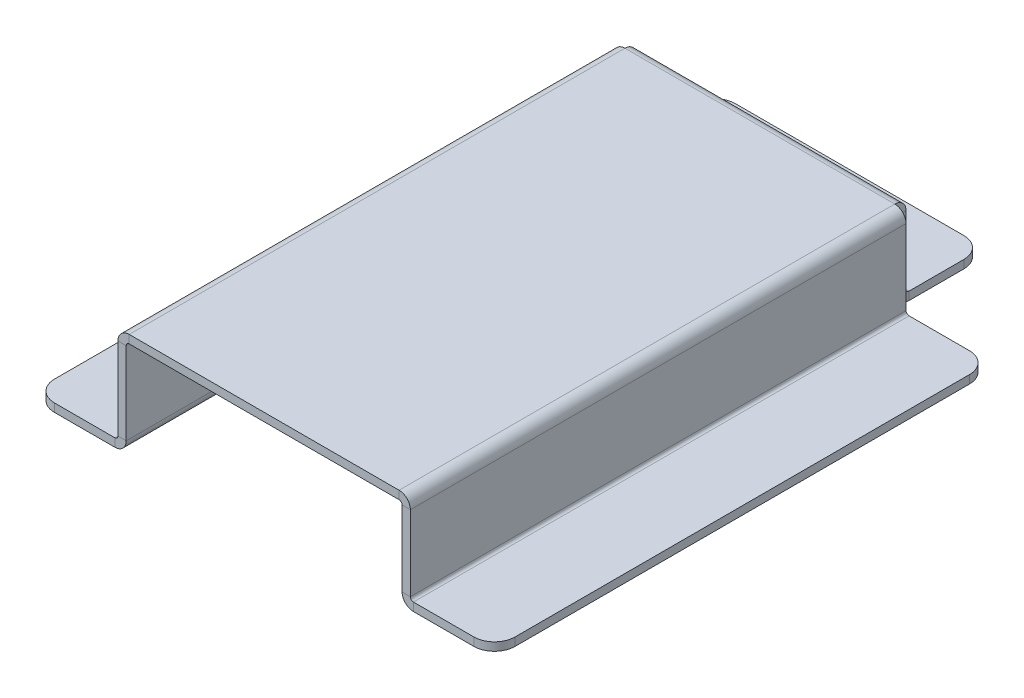
from build123d import *

# Parameters (mm, degrees)
SKETCH3_W                    = 66.802
SKETCH3_H                    = 120
BASE_FLANGE1_DEPTH           = 1.99
EDGE_FLANGE1_STRIP_W         = 9.4332
EDGE_FLANGE1_STRIP_H         = 1.99
EDGE_FLANGE1_STRIP_CUT_DEPTH = 120
EDGE_FLANGE1_DEPTH           = 120
EDGE_FLANGE2_STRIP_W         = 9.4332
EDGE_FLANGE2_STRIP_H         = 1.99
EDGE_FLANGE2_STRIP_CUT_DEPTH = 120
EDGE_FLANGE2_DEPTH           = 120
EDGE_FLANGE3_STRIP_W         = 9.4332
EDGE_FLANGE3_STRIP_H         = 1.99
EDGE_FLANGE3_STRIP_CUT_DEPTH = 120
EDGE_FLANGE3_DEPTH           = 120
EDGE_FLANGE4_STRIP_W         = 9.4332
EDGE_FLANGE4_STRIP_H         = 1.99
EDGE_FLANGE4_STRIP_CUT_DEPTH = 120
EDGE_FLANGE4_DEPTH           = 120
EDGE_FLANGE6_DEPTH           = 65.3288
EDGE_FLANGE7_STRIP_W         = 9.4332
EDGE_FLANGE7_STRIP_H         = 1.99
EDGE_FLANGE7_STRIP_CUT_DEPTH = 65.3288
EDGE_FLANGE7_DEPTH           = 65.3288
FILLET1_R                    = 5


# Sheet-metal steps are written as plain solids
with BuildPart() as part:
    # Sketch3 → Base-Flange1 (new body)
    with BuildSketch(Plane(origin=(0, 0, 0), x_dir=(1, 0, 0), z_dir=(0, 1, 0))):
        Rectangle(SKETCH3_W, SKETCH3_H)
    extrude(amount=-BASE_FLANGE1_DEPTH)

    # Edge-Flange1 strip (across the edge) → Edge-Flange1 strip cut (cut)
    with BuildSketch(Plane(origin=(33.401, -1.99, -60), x_dir=(-1, 0, 0), z_dir=(0, 0, 1))):
        with Locations((-3.98, -0.995)):
            Rectangle(EDGE_FLANGE1_STRIP_W, EDGE_FLANGE1_STRIP_H)
    extrude(amount=EDGE_FLANGE1_STRIP_CUT_DEPTH, mode=Mode.SUBTRACT)

    # Edge-Flange1 section (across the edge) → Edge-Flange1 (add)
    with BuildSketch(Plane(origin=(33.401, -1.99, -60), x_dir=(-1, 0, 0), z_dir=(0, 0, 1))):
        with BuildLine():
            Line((-1.99, 0.7366), (-1.99, 21.71))
            Line((-1.99, 21.71), (0, 21.71))
            Line((0, 21.71), (0, 0.7366))
            ThreePointArc((0, 0.7366), (0.215745145, 0.215745145), (0.7366, 0))
            Line((0.7366, 0), (0.7366, -1.99))
            ThreePointArc((0.7366, -1.99), (-1.19139735, -1.19139735), (-1.99, 0.7366))
        make_face()
    extrude(amount=EDGE_FLANGE1_DEPTH)

    # Edge-Flange2 strip (across the edge) → Edge-Flange2 strip cut (cut)
    with BuildSketch(Plane(origin=(-33.401, -1.99, 60), x_dir=(1, 0, 0), z_dir=(0, 0, -1))):
        with Locations((-3.98, -0.995)):
            Rectangle(EDGE_FLANGE2_STRIP_W, EDGE_FLANGE2_STRIP_H)
    extrude(amount=EDGE_FLANGE2_STRIP_CUT_DEPTH, mode=Mode.SUBTRACT)

    # Edge-Flange2 section (across the edge) → Edge-Flange2 (add)
    with BuildSketch(Plane(origin=(-33.401, -1.99, 60), x_dir=(1, 0, 0), z_dir=(0, 0, -1))):
        with BuildLine():
            Line((-1.99, 0.7366), (-1.99, 23.41))
            Line((-1.99, 23.41), (0, 23.41))
            Line((0, 23.41), (0, 0.7366))
            ThreePointArc((0, 0.7366), (0.215745145, 0.215745145), (0.7366, 0))
            Line((0.7366, 0), (0.7366, -1.99))
            ThreePointArc((0.7366, -1.99), (-1.19139735, -1.19139735), (-1.99, 0.7366))
        make_face()
    extrude(amount=EDGE_FLANGE2_DEPTH)

    # Edge-Flange3 strip (across the edge) → Edge-Flange3 strip cut (cut)
    with BuildSketch(Plane(origin=(35.391, -23.7, 60), x_dir=(0, 1, 0), z_dir=(0, 0, -1))):
        with Locations((-1.99, -0.995)):
            Rectangle(EDGE_FLANGE3_STRIP_W, EDGE_FLANGE3_STRIP_H)
    extrude(amount=EDGE_FLANGE3_STRIP_CUT_DEPTH, mode=Mode.SUBTRACT)

    # Edge-Flange3 section (across the edge) → Edge-Flange3 (add)
    with BuildSketch(Plane(origin=(35.391, -23.7, 60), x_dir=(0, 1, 0), z_dir=(0, 0, -1))):
        with BuildLine():
            Line((0, 0.7366), (0, 20.362))
            Line((0, 20.362), (1.99, 20.362))
            Line((1.99, 20.362), (1.99, 0.7366))
            ThreePointArc((1.99, 0.7366), (2.205745145, 0.215745145), (2.7266, 0))
            Line((2.7266, 0), (2.7266, -1.99))
            ThreePointArc((2.7266, -1.99), (0.79860265, -1.19139735), (0, 0.7366))
        make_face()
    extrude(amount=EDGE_FLANGE3_DEPTH)

    # Edge-Flange4 strip (across the edge) → Edge-Flange4 strip cut (cut)
    with BuildSketch(Plane(origin=(-35.391, -25.4, -60), x_dir=(0, 1, 0), z_dir=(0, 0, 1))):
        with Locations((-1.99, -0.995)):
            Rectangle(EDGE_FLANGE4_STRIP_W, EDGE_FLANGE4_STRIP_H)
    extrude(amount=EDGE_FLANGE4_STRIP_CUT_DEPTH, mode=Mode.SUBTRACT)

    # Edge-Flange4 section (across the edge) → Edge-Flange4 (add)
    with BuildSketch(Plane(origin=(-35.391, -25.4, -60), x_dir=(0, 1, 0), z_dir=(0, 0, 1))):
        with BuildLine():
            Line((0, 0.7366), (0, 20.362))
            Line((0, 20.362), (1.99, 20.362))
            Line((1.99, 20.362), (1.99, 0.7366))
            ThreePointArc((1.99, 0.7366), (2.205745145, 0.215745145), (2.7266, 0))
            Line((2.7266, 0), (2.7266, -1.99))
            ThreePointArc((2.7266, -1.99), (0.79860265, -1.19139735), (0, 0.7366))
        make_face()
    extrude(amount=EDGE_FLANGE4_DEPTH)

    # Edge-Flange6 section (across the edge) → Edge-Flange6 (add)
    with BuildSketch(Plane(origin=(-32.6644, -1.99, -60.7366), x_dir=(0, 0, 1), z_dir=(1, 0, 0))):
        with BuildLine():
            Line((-1.99, 0.7366), (-1.99, 17.99))
            Line((-1.99, 17.99), (0, 17.99))
            Line((0, 17.99), (0, 0.7366))
            ThreePointArc((0, 0.7366), (0.215745145, 0.215745145), (0.7366, 0))
            Line((0.7366, 0), (0.7366, -1.99))
            ThreePointArc((0.7366, -1.99), (-1.19139735, -1.19139735), (-1.99, 0.7366))
        make_face()
    extrude(amount=EDGE_FLANGE6_DEPTH)

    # Edge-Flange7 strip (across the edge) → Edge-Flange7 strip cut (cut)
    with BuildSketch(Plane(origin=(32.6644, -19.98, -62.7266), x_dir=(0, 1, 0), z_dir=(-1, 0, 0))):
        with Locations((-3.98, -0.995)):
            Rectangle(EDGE_FLANGE7_STRIP_W, EDGE_FLANGE7_STRIP_H)
    extrude(amount=EDGE_FLANGE7_STRIP_CUT_DEPTH, mode=Mode.SUBTRACT)

    # Edge-Flange7 section (across the edge) → Edge-Flange7 (add)
    with BuildSketch(Plane(origin=(32.6644, -19.98, -62.7266), x_dir=(0, 1, 0), z_dir=(-1, 0, 0))):
        with BuildLine():
            Line((-1.99, 0.7366), (-1.99, 19.01))
            Line((-1.99, 19.01), (0, 19.01))
            Line((0, 19.01), (0, 0.7366))
            ThreePointArc((0, 0.7366), (0.215745145, 0.215745145), (0.7366, 0))
            Line((0.7366, 0), (0.7366, -1.99))
            ThreePointArc((0.7366, -1.99), (-1.19139735, -1.19139735), (-1.99, 0.7366))
        make_face()
    extrude(amount=EDGE_FLANGE7_DEPTH)

    # Fillet1
    fillet1_edges = [part.edges().sort_by_distance(p)[0] for p in [
        (55.753, -22.705, 60),
        (55.753, -22.705, -60),
        (-55.753, -24.405, -60),
        (-55.753, -24.405, 60),
        (32.6644, -20.975, -81.7366),
        (-32.6644, -20.975, -81.7366),
    ]]
    fillet(fillet1_edges, radius=FILLET1_R)


solid = part.part
